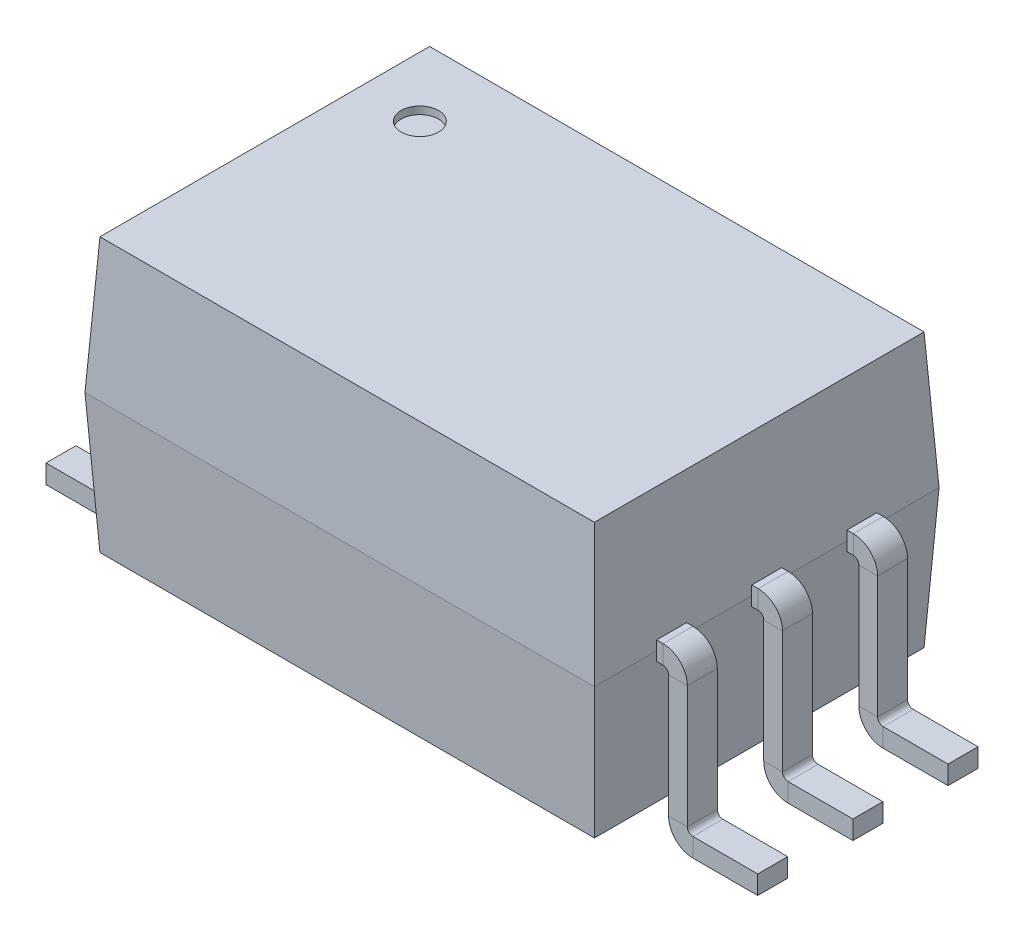
from build123d import *
from OCP.BRepFilletAPI import BRepFilletAPI_MakeChamfer

# Parameters (mm, degrees)
SKETCH_1_W                = 6.8
SKETCH_1_H                = 4.6
EXTRUDE_292_DEPTH         = 3.65
CHAMFER_365_SIZE          = 1.8
CHAMFER_365_SIZE2         = 0.1
CHAMFER_503_SIZE          = 1.85
CHAMFER_503_SIZE_2        = 0.1
ESBO_O6_W                 = 0.4
ESBO_O6_H                 = 0.25
PATTERN_LINEAR_1113_COUNT = 3
PATTERN_LINEAR_1113_PITCH = 1.27
SKETCH_11_R               = 0.25
CUT_EXTRUDE_1_DEPTH       = 0.1


with BuildPart() as part:
    # Эскиз1 → Extrude 292 (new body)
    with BuildSketch(Plane(origin=(0, 0, 0), x_dir=(1, 0, 0), z_dir=(0, 1, 0))):
        Rectangle(SKETCH_1_W, SKETCH_1_H)
    extrude(amount=EXTRUDE_292_DEPTH)

    # Chamfer 365: one chamfer whose edges measure the first distance from different faces: ONE call of the kernel's chamfer builder (chamfer() names one face for all edges)
    chamfer_365_edges_1 = [part.edges().sort_by_distance(p)[0] for p in [
        (-3.4, 3.65, 0),
    ]]
    chamfer_365_side_1 = [part.faces().sort_by_distance(p)[0] for p in [
        (-3.4, 1.825, 0),
    ]]
    chamfer_365_edges_2 = [part.edges().sort_by_distance(p)[0] for p in [
        (0, 3.65, 2.3),
    ]]
    chamfer_365_side_2 = [part.faces().sort_by_distance(p)[0] for p in [
        (0, 1.825, 2.3),
    ]]
    chamfer_365_edges_3 = [part.edges().sort_by_distance(p)[0] for p in [
        (3.4, 3.65, 0),
    ]]
    chamfer_365_side_3 = [part.faces().sort_by_distance(p)[0] for p in [
        (3.4, 1.825, 0),
    ]]
    chamfer_365_edges_4 = [part.edges().sort_by_distance(p)[0] for p in [
        (0, 3.65, -2.3),
    ]]
    chamfer_365_side_4 = [part.faces().sort_by_distance(p)[0] for p in [
        (0, 1.825, -2.3),
    ]]
    chamfer_365 = BRepFilletAPI_MakeChamfer(part.part.solid().wrapped)
    for e in chamfer_365_edges_1:
        chamfer_365.Add(CHAMFER_365_SIZE, CHAMFER_365_SIZE2, e.wrapped, chamfer_365_side_1[0].wrapped)  # the first distance lies on this face
    for e in chamfer_365_edges_2:
        chamfer_365.Add(CHAMFER_365_SIZE, CHAMFER_365_SIZE2, e.wrapped, chamfer_365_side_2[0].wrapped)  # the first distance lies on this face
    for e in chamfer_365_edges_3:
        chamfer_365.Add(CHAMFER_365_SIZE, CHAMFER_365_SIZE2, e.wrapped, chamfer_365_side_3[0].wrapped)  # the first distance lies on this face
    for e in chamfer_365_edges_4:
        chamfer_365.Add(CHAMFER_365_SIZE, CHAMFER_365_SIZE2, e.wrapped, chamfer_365_side_4[0].wrapped)  # the first distance lies on this face
    add(Compound.cast(chamfer_365.Shape()), mode=Mode.REPLACE)

    # Chamfer 503
    chamfer_503_edges_1 = [part.edges().sort_by_distance(p)[0] for p in [
        (-3.4, 0, 0),
    ]]
    chamfer_503_side_1 = [part.faces().sort_by_distance(p)[0] for p in [
        (-3.4, 0.002, 0),
    ]]
    chamfer_503_edges_2 = [part.edges().sort_by_distance(p)[0] for p in [
        (0, 0, -2.3),
    ]]
    chamfer_503_side_2 = [part.faces().sort_by_distance(p)[0] for p in [
        (0, 0.002, -2.3),
    ]]
    chamfer_503_edges_3 = [part.edges().sort_by_distance(p)[0] for p in [
        (3.4, 0, 0),
    ]]
    chamfer_503_side_3 = [part.faces().sort_by_distance(p)[0] for p in [
        (3.398, 0, 0),
    ]]
    chamfer_503_edges_4 = [part.edges().sort_by_distance(p)[0] for p in [
        (0, 0, 2.3),
    ]]
    chamfer_503_side_4 = [part.faces().sort_by_distance(p)[0] for p in [
        (0, 0, 2.298),
    ]]
    chamfer_503 = BRepFilletAPI_MakeChamfer(part.part.solid().wrapped)
    for e in chamfer_503_edges_1:
        chamfer_503.Add(CHAMFER_503_SIZE - 0.0001, CHAMFER_503_SIZE_2 - 0.0001, e.wrapped, chamfer_503_side_1[0].wrapped)
    for e in chamfer_503_edges_2:
        chamfer_503.Add(CHAMFER_503_SIZE - 0.0001, CHAMFER_503_SIZE_2 - 0.0001, e.wrapped, chamfer_503_side_2[0].wrapped)
    for e in chamfer_503_edges_3:
        chamfer_503.Add(CHAMFER_503_SIZE_2 - 0.0001, CHAMFER_503_SIZE - 0.0001, e.wrapped, chamfer_503_side_3[0].wrapped)
    for e in chamfer_503_edges_4:
        chamfer_503.Add(CHAMFER_503_SIZE_2 - 0.0001, CHAMFER_503_SIZE - 0.0001, e.wrapped, chamfer_503_side_4[0].wrapped)
    add(Compound.cast(chamfer_503.Shape()), mode=Mode.REPLACE)  # a hair under: the kernel refuses the full size

    # Эскиз11 → Вырез метка 1 ножки (cut)
    with BuildSketch(Plane(origin=(0, 3.65, 0), x_dir=(1, 0, 0), z_dir=(0, 1, 0))):
        with Locations(Location((-2.5, 1.27, 0), (0, 0, 270))):
            Circle(SKETCH_11_R)
    extrude(amount=-CUT_EXTRUDE_1_DEPTH, mode=Mode.SUBTRACT)


with BuildPart() as body_2:
    # Sweep 758: sweep along a path in Esboço2
    with BuildLine(Plane.XY) as sweep_758_path:
        Line((-3.4, 1.85), (-3.485, 1.85))
        ThreePointArc((-3.485, 1.85), (-3.626421356, 1.791421356), (-3.685, 1.65))
        Line((-3.685, 1.65), (-3.685, 0.02))
        ThreePointArc((-3.685, 0.02), (-3.743578644, -0.121421356), (-3.885, -0.18))
        Line((-3.885, -0.18), (-4.75, -0.18))
    # Esboço6 → Sweep 758 (sweep)
    with BuildSketch(Plane(origin=(-4.75, 0, 0), x_dir=(0, 0, -1), z_dir=(1, 0, 0))):
        with Locations((0, -0.18)):
            Rectangle(ESBO_O6_W, ESBO_O6_H)
    sweep(path=sweep_758_path.line)


with BuildPart() as body_2_1:
    # Move Face 801: read off the stored shape, not the designer's step
    # Move Face 801: moved
    add(body_2.part.moved(Location((0, 0, 1.27))))


with BuildPart() as pattern_linear_1113_1:
    # Pattern Linear 1113: pattern copy
    add(body_2_1.part.moved(Location(Vector(0, 0, -1) * (1 * PATTERN_LINEAR_1113_PITCH))))


with BuildPart() as pattern_linear_1113_2:
    # Pattern Linear 1113: pattern copy
    add(body_2_1.part.moved(Location(Vector(0, 0, -1) * (2 * PATTERN_LINEAR_1113_PITCH))))


with BuildPart() as body_5:
    # Mirror 1204: mirrored copy
    add(body_2_1.part.mirror(Plane(origin=(0, 0, 0), x_dir=(0, 0, 1), z_dir=(1, 0, 0))))


with BuildPart() as body_6:
    # Mirror 1204 2: mirrored copy
    add(pattern_linear_1113_1.part.mirror(Plane(origin=(0, 0, 0), x_dir=(0, 0, 1), z_dir=(1, 0, 0))))


with BuildPart() as body_7:
    # Mirror 1204 3: mirrored copy
    add(pattern_linear_1113_2.part.mirror(Plane(origin=(0, 0, 0), x_dir=(0, 0, 1), z_dir=(1, 0, 0))))


solid = Compound([part.part, body_2_1.part, pattern_linear_1113_1.part, pattern_linear_1113_2.part, body_5.part, body_6.part, body_7.part])
